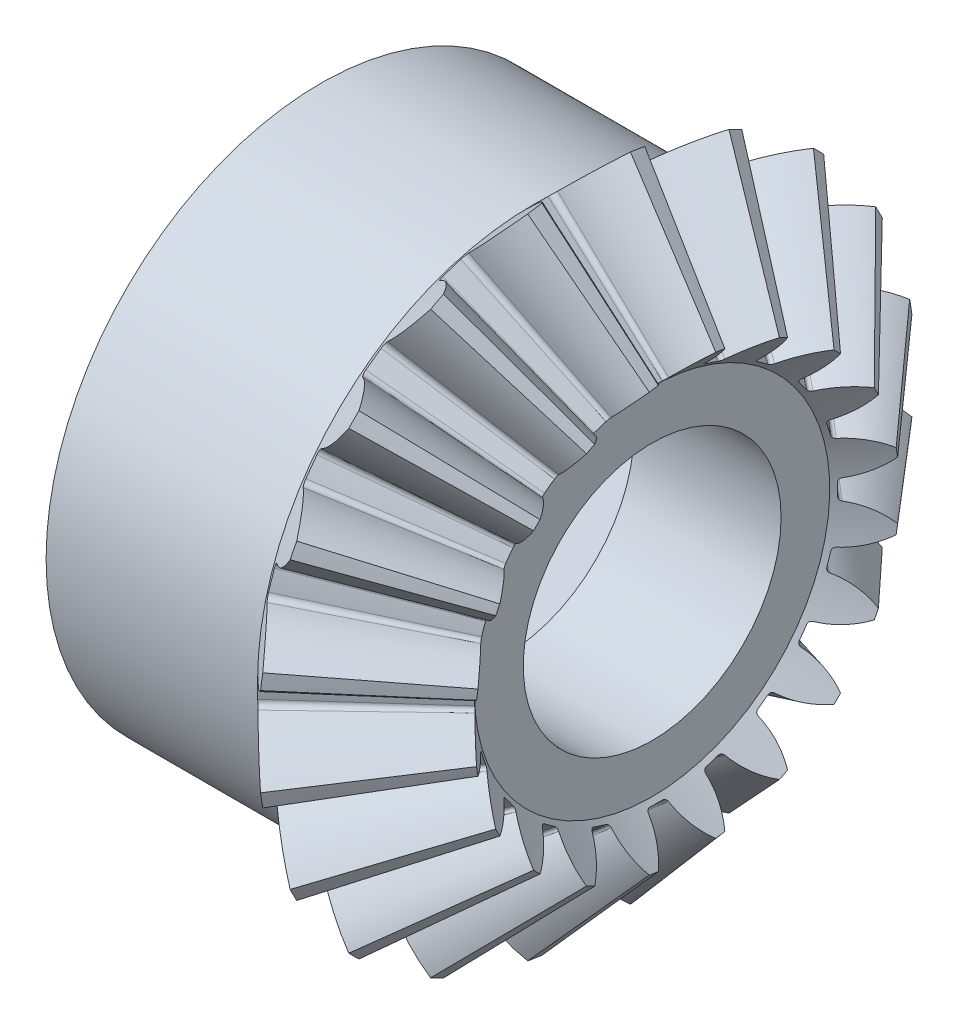
from build123d import *

# Parameters (mm, degrees)
TEETHCUTS_COUNT     = 20
TEETHCUTS_ANGLE     = 342
HUBSKE_R            = 4
HUB_DEPTH           = 2.444190931
BORSKE_R            = 2.5
BORE_DEPTH          = 7.9700508
SKETCH1_R           = 2.892259877
SKETCH1_R_2         = 1.1
BOSS_EXTRUDE2_DEPTH = 1.1
BOSS_EXTRUDE3_START = -2.444190931
SKETCH2_R           = 4.474089332
SKETCH2_R_2         = 2.5
SKETCH2_R_3         = 1.1
BOSS_EXTRUDE3_DEPTH = 2.444190931
SKETCH3_R           = 2.6
SKETCH3_R_2         = 2.5
CUT_EXTRUDE1_DEPTH  = 3.297895383
SKETCH5_R           = 4.474089332
SKETCH5_R_2         = 2.6
BOSS_EXTRUDE4_DEPTH = 1
CUT_EXTRUDE3_DEPTH  = 3
SKETCH7_R           = 3.094273642
SKETCH7_R_2         = 1.1
BOSS_EXTRUDE5_DEPTH = 1.297895383
SKETCH8_R           = 1.688365424
CUT_EXTRUDE4_DEPTH  = 3
CUT_EXTRUDE5_DEPTH  = 3
SKETCH10_R          = 2.1
CUT_EXTRUDE6_DEPTH  = 10


with BuildPart() as part:
    # BasProSke → Base-Revolve (revolve)
    with BuildSketch(Plane(origin=(0, 0, 0), x_dir=(1, 0, 0), z_dir=(0, 1, 0)), mode=Mode.PRIVATE) as base_revolve_sk:
        Polygon((0, 0), (0, 4.474089332), (0.87946406, 5.35355339), (2.522231011, 3.460786436), (1.953704452, 2.892259877), (1.953704452, 0), align=None)
    revolve(base_revolve_sk.sketch.rotate(Axis((-10, 0, 0), (1, 0, 0)), 180), axis=Axis((-10, 0, 0), (1, 0, 0)))

    # ToothCut: read off the stored shape, not the designer's step
    # ToothCut: loft between two sections, ruled curve by curve
    toothcut_from = [
        Edge.make_bspline([(5.531952177, 0.006041508, -0.00939629), (5.527732384, 0.001821715, -0.014822672), (5.522057014, -0.003853655, -0.014023113), (5.518677121, -0.007233548, -0.007526068)], [0, 0, 0, 0, 1, 1, 1, 1], 3, [1, 0.779688158, 0.779688158, 1]),
        Edge.make_bspline([(5.518677121, -0.007233548, 0.007526068), (5.522057014, -0.003853655, 0.014023113), (5.527732384, 0.001821715, 0.014822672), (5.531952177, 0.006041508, 0.00939629)], [0, 0, 0, 0, 1, 1, 1, 1], 3, [1, 0.779688158, 0.779688158, 1]),
        Edge.make_bspline([(5.518677121, -0.007233548, -0.007526068), (5.518172328, -0.007738341, -0.006555724), (5.517769574, -0.008141095, -0.005494225), (5.517476945, -0.008433724, -0.004362882)], [0, 0, 0, 0, 1, 1, 1, 1], 3, [1, 0.993308328, 0.993308328, 1]),
        Edge.make_bspline([(5.517476945, -0.008433724, 0.004362882), (5.517769574, -0.008141095, 0.005494225), (5.518172328, -0.007738341, 0.006555724), (5.518677121, -0.007233548, 0.007526068)], [0, 0, 0, 0, 1, 1, 1, 1], 3, [1, 0.993308328, 0.993308328, 1]),
        Edge.make_bspline([(5.517476945, -0.008433724, -0.004362882), (5.516740525, -0.009170144, -0.001515795), (5.516740525, -0.009170144, 0.001515795), (5.517476945, -0.008433724, 0.004362882)], [0, 0, 0, 0, 1, 1, 1, 1], 3, [1, 0.959426823, 0.959426823, 1]),
        Edge.make_line((5.531952177, 0.006041508, 0.00939629), (5.531952177, 0.006041508, -0.00939629)),
    ]
    toothcut_to = [
        Edge.make_bspline([(0.916293029, 5.390382359, -0.804029197), (0.708519064, 5.182608394, -0.511267893), (0.448006964, 4.922096295, -0.320700021), (0.158992745, 4.633082077, -0.25005453)], [0, 0, 0, 0, 1, 1, 1, 1], 3, [1, 0.968989264, 0.968989264, 1]),
        Edge.make_bspline([(0.158992745, 4.633082077, 0.25005453), (0.448006964, 4.922096295, 0.320700021), (0.708519064, 5.182608394, 0.511267893), (0.916293029, 5.390382359, 0.804029197)], [0, 0, 0, 0, 1, 1, 1, 1], 3, [1, 0.968989264, 0.968989264, 1]),
        Edge.make_bspline([(0.158992745, 4.633082077, -0.25005453), (0.124287502, 4.598376834, -0.241571318), (0.102074861, 4.576164193, -0.20291812), (0.103299279, 4.57738861, -0.153139869)], [0, 0, 0, 0, 1, 1, 1, 1], 3, [1, 0.835762325, 0.835762325, 1]),
        Edge.make_bspline([(0.103299279, 4.57738861, 0.153139869), (0.102074861, 4.576164193, 0.20291812), (0.124287502, 4.598376834, 0.241571318), (0.158992745, 4.633082077, 0.25005453)], [0, 0, 0, 0, 1, 1, 1, 1], 3, [1, 0.835762325, 0.835762325, 1]),
        Edge.make_bspline([(0.103299279, 4.57738861, -0.153139869), (0.105810005, 4.579899337, -0.051067203), (0.105810005, 4.579899337, 0.051067203), (0.103299279, 4.57738861, 0.153139869)], [0, 0, 0, 0, 1, 1, 1, 1], 3, [1, 0.99959701, 0.99959701, 1]),
        Edge.make_line((0.916293029, 5.390382359, 0.804029197), (0.916293029, 5.390382359, -0.804029197)),
    ]
    toothcut = Solid(Shell([*[Face.make_surface_from_curves(toothcut_from[k], toothcut_to[k]) for k in range(6)], Face(Wire(toothcut_from)), Face(Wire(toothcut_to))]))
    add(toothcut, mode=Mode.SUBTRACT)

    # TeethCuts: ToothCut ×20 about axis
    teethcuts_axis = Axis((-10, 0, 0), (1, 0, 0))
    for i in range(1, TEETHCUTS_COUNT):
        add(toothcut.rotate(teethcuts_axis, i * TEETHCUTS_ANGLE / (TEETHCUTS_COUNT - 1)), mode=Mode.SUBTRACT)

    # HubSke → Hub (add)
    with BuildSketch(Plane.ZY):
        with Locations(Location((0, 0, 0), (0, 0, 180))):
            Circle(HUBSKE_R)
    extrude(amount=HUB_DEPTH)

    # BorSke → Bore (cut, symmetric)
    with BuildSketch(Plane(origin=(0, 0, 0), x_dir=(0, 0, -1), z_dir=(1, 0, 0))):
        with Locations(Location((0, 0, 0), (0, 0, 180))):
            Circle(BORSKE_R)
    extrude(amount=BORE_DEPTH, both=True, mode=Mode.SUBTRACT)

    # Sketch1 → Boss-Extrude2 (add)
    with BuildSketch(Plane(origin=(1.953704452, 0, 0), x_dir=(0, 0, -1), z_dir=(1, 0, 0))):
        Circle(SKETCH1_R)
        Circle(SKETCH1_R_2, mode=Mode.SUBTRACT)
    extrude(amount=-BOSS_EXTRUDE2_DEPTH)

    # Sketch2 → Boss-Extrude3 (add)
    # profile 1 of 2: a face of its own
    with BuildSketch(Plane.ZY.offset(2.444190931).offset(BOSS_EXTRUDE3_START)):
        Circle(SKETCH2_R)
        Circle(SKETCH2_R_2, mode=Mode.SUBTRACT)
    # profile 2 of 2: a face of its own
    with BuildSketch(Plane.ZY.offset(2.444190931).offset(BOSS_EXTRUDE3_START)):
        with Locations(Location((0, 0, 0), (0, 0, 180))):
            Circle(SKETCH2_R_3)
    extrude(amount=BOSS_EXTRUDE3_DEPTH)


with BuildPart() as boss_extrude3_kept_piece:
    # of the separate pieces the step leaves, the one the design keeps (boss_extrude3_pieces_kept)
    add(part.part.solids().sort_by_distance((0, 0, 4.474089332))[0])

    # Sketch3 → Cut-Extrude1 (cut)
    with BuildSketch(Plane.ZY.offset(2.444190931)):
        Circle(SKETCH3_R)
        Circle(SKETCH3_R_2, mode=Mode.SUBTRACT)
    extrude(amount=-CUT_EXTRUDE1_DEPTH, mode=Mode.SUBTRACT)

    # Sketch5 → Boss-Extrude4 (add)
    with BuildSketch(Plane.ZY.offset(2.444190931)):
        Circle(SKETCH5_R)
        Circle(SKETCH5_R_2, mode=Mode.SUBTRACT)
    extrude(amount=BOSS_EXTRUDE4_DEPTH)

    # Sketch6 → Cut-Extrude3 (cut)
    with BuildSketch(Plane.ZY.offset(3.444190931)):
        Polygon((1.843862888, 3.661079483), (-2.248656394, 3.427371844), (-4.092519282, -0.23370764), (-1.843862888, -3.661079483), (2.248656394, -3.427371844), (4.092519282, 0.23370764), align=None)
    extrude(amount=-CUT_EXTRUDE3_DEPTH, mode=Mode.SUBTRACT)

    # Sketch7 → Boss-Extrude5 (add)
    with BuildSketch(Plane.ZY.offset(0.444190931)):
        Circle(SKETCH7_R)
        with Locations(Location((0, 0, 0), (0, 0, 180))):
            Circle(SKETCH7_R_2, mode=Mode.SUBTRACT)
    extrude(amount=-BOSS_EXTRUDE5_DEPTH)

    # Sketch8 → Cut-Extrude4 (cut)
    with BuildSketch(Plane.ZY.offset(0.444190931)):
        Circle(SKETCH8_R)
    extrude(amount=-CUT_EXTRUDE4_DEPTH, mode=Mode.SUBTRACT)

    # Sketch9 → Cut-Extrude5 (cut)
    with BuildSketch(Plane.ZY.offset(3.444190931)):
        Polygon((1.895802688, 3.764208483), (-2.311998828, 3.52391753), (-4.207801515, -0.240290953), (-1.895802688, -3.764208483), (2.311998828, -3.52391753), (4.207801515, 0.240290953), align=None)
    extrude(amount=-CUT_EXTRUDE5_DEPTH, mode=Mode.SUBTRACT)

    # Sketch10 → Cut-Extrude6 (cut)
    with BuildSketch(Plane(origin=(1.953704452, 0, 0), x_dir=(0, 0, -1), z_dir=(1, 0, 0))):
        Circle(SKETCH10_R)
    extrude(amount=-CUT_EXTRUDE6_DEPTH, mode=Mode.SUBTRACT)


solid = boss_extrude3_kept_piece.part
